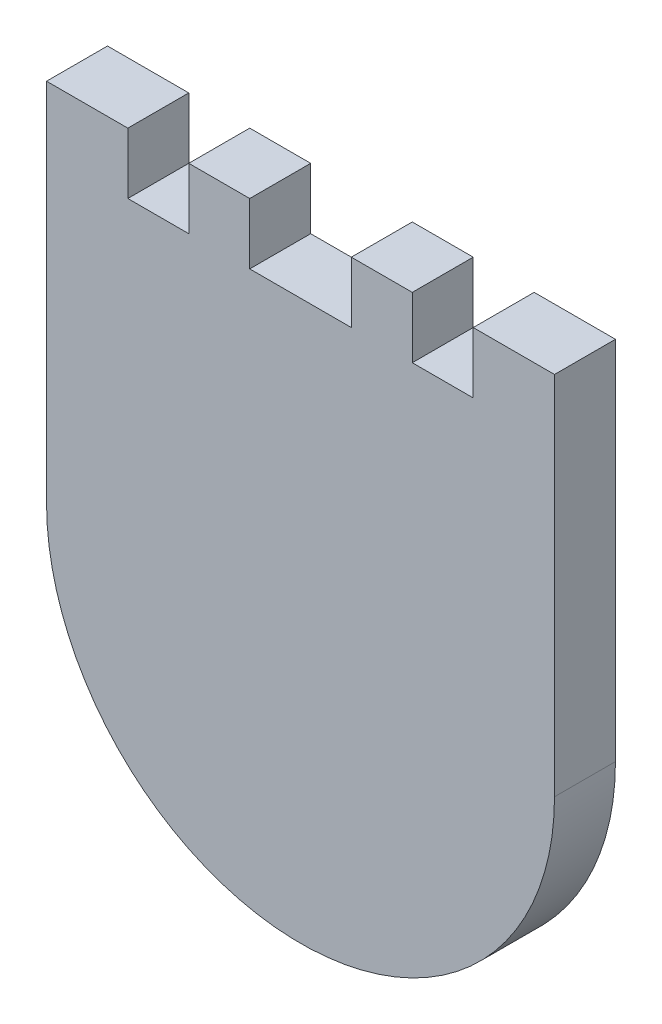
from build123d import *

# Parameters (mm, degrees)
SKETCH2_R                = 25
BOSS_EXTRUDE1_DEPTH      = 6
BOSS_EXTRUDE2_START      = -4
BOSS_EXTRUDE2_DEPTH      = 4
BOSS_EXTRUDE4_DEPTH      = 6
SKETCH5_W                = 8
SKETCH5_H                = 6
SKETCH5_W_2              = 6
BOSS_EXTRUDE5_DEPTH      = 6
MOVE_START               = 31
MOVE_FACE1_OUTLINE_W     = 8
MOVE_FACE1_OUTLINE_H     = 6
MOVE_FACE1_OUTLINE_W_2   = 6
MOVE_FACE1_DEPTH         = 5
MOVE_START_2             = 25
MOVE_FACE1_2_OUTLINE_W   = 6
MOVE_FACE1_2_OUTLINE_H   = 6
MOVE_FACE1_2_OUTLINE_W_2 = 10
MOVE_FACE1_2_DEPTH       = 5


# Read off the part's stored shape, not the designer's step: Move Face1
with BuildPart() as part:
    # Sketch2 → Boss-Extrude1 (new body)
    with BuildSketch(Plane.XY):
        Circle(SKETCH2_R)
        with BuildLine():
            Line((-2.73463726, -2.341315668), (-1.8, -14))
            ThreePointArc((-1.8, -14), (0, -15.8), (1.8, -14))
            Line((1.8, -14), (2.73463726, -2.341315668))
            ThreePointArc((2.73463726, -2.341315668), (3.6, 0), (2.73463726, 2.341315668))
            Line((2.73463726, 2.341315668), (1.8, 14))
            ThreePointArc((1.8, 14), (0, 15.8), (-1.8, 14))
            Line((-1.8, 14), (-2.73463726, 2.341315668))
            ThreePointArc((-2.73463726, 2.341315668), (-3.6, 0), (-2.73463726, -2.341315668))
        make_face(mode=Mode.SUBTRACT)
    extrude(amount=BOSS_EXTRUDE1_DEPTH)

    # Sketch3 → Boss-Extrude2 (add)
    with BuildSketch(Plane.XY.offset(6).offset(BOSS_EXTRUDE2_START)):
        with BuildLine():
            Line((2.73463726, 2.341315668), (1.8, 14))
            ThreePointArc((1.8, 14), (0, 15.8), (-1.8, 14))
            Line((-1.8, 14), (-2.73463726, 2.341315668))
            ThreePointArc((-2.73463726, 2.341315668), (-3.6, 0), (-2.73463726, -2.341315668))
            Line((-2.73463726, -2.341315668), (-1.8, -14))
            ThreePointArc((-1.8, -14), (0, -15.8), (1.8, -14))
            Line((1.8, -14), (2.73463726, -2.341315668))
            ThreePointArc((2.73463726, -2.341315668), (3.6, 0), (2.73463726, 2.341315668))
        make_face()
    extrude(amount=BOSS_EXTRUDE2_DEPTH)


with BuildPart() as body_2:
    # Sketch4 → Boss-Extrude4 (new body)
    with BuildSketch(Plane(origin=(0, 0, 0), x_dir=(-1, 0, 0), z_dir=(0, 0, -1))):
        with BuildLine():
            Line((25, 0), (25, 25))
            Line((25, 25), (0, 25))
            ThreePointArc((0, 25), (17.67766953, 17.67766953), (25, 0))
        make_face()
    extrude(amount=-BOSS_EXTRUDE4_DEPTH)


with BuildPart() as body_3:
    # Mirror1: mirrored copy
    add(body_2.part.mirror(Plane.ZY))


with BuildPart() as part_1:
    add(part.part)

    # Combine1: union body 2, body 3
    add(body_2.part)
    add(body_3.part)

    # Sketch5 → Boss-Extrude5 (add)
    with BuildSketch(Plane(origin=(0, 25, 0), x_dir=(1, 0, 0), z_dir=(0, 1, 0))):
        with Locations((21, -3)):
            Rectangle(SKETCH5_W, SKETCH5_H)
        with Locations((-8, -3)):
            Rectangle(SKETCH5_W_2, SKETCH5_H)
        with Locations((8, -3)):
            Rectangle(SKETCH5_W_2, SKETCH5_H)
        with Locations((-21, -3)):
            Rectangle(SKETCH5_W, SKETCH5_H)
    extrude(amount=BOSS_EXTRUDE5_DEPTH)

    # Move Face1 outline → Move Face1 (add)
    with BuildSketch(Plane(origin=(0, 0, 0), x_dir=(1, 0, 0), z_dir=(0, 1, 0)).offset(MOVE_START)):
        with Locations((-21, -3)):
            Rectangle(MOVE_FACE1_OUTLINE_W, MOVE_FACE1_OUTLINE_H)
        with Locations((-8, -3)):
            Rectangle(MOVE_FACE1_OUTLINE_W_2, MOVE_FACE1_OUTLINE_H)
        with Locations((8, -3)):
            Rectangle(MOVE_FACE1_OUTLINE_W_2, MOVE_FACE1_OUTLINE_H)
        with Locations((21, -3)):
            Rectangle(MOVE_FACE1_OUTLINE_W, MOVE_FACE1_OUTLINE_H)
    extrude(amount=MOVE_FACE1_DEPTH)

    # Move Face1 2 outline → Move Face1 2 (add)
    with BuildSketch(Plane(origin=(0, 0, 0), x_dir=(1, 0, 0), z_dir=(0, 1, 0)).offset(MOVE_START_2)):
        with Locations((-14, -3)):
            Rectangle(MOVE_FACE1_2_OUTLINE_W, MOVE_FACE1_2_OUTLINE_H)
        with Locations((0, -3)):
            Rectangle(MOVE_FACE1_2_OUTLINE_W_2, MOVE_FACE1_2_OUTLINE_H)
        with Locations((14, -3)):
            Rectangle(MOVE_FACE1_2_OUTLINE_W, MOVE_FACE1_2_OUTLINE_H)
    extrude(amount=MOVE_FACE1_2_DEPTH)


solid = part_1.part
